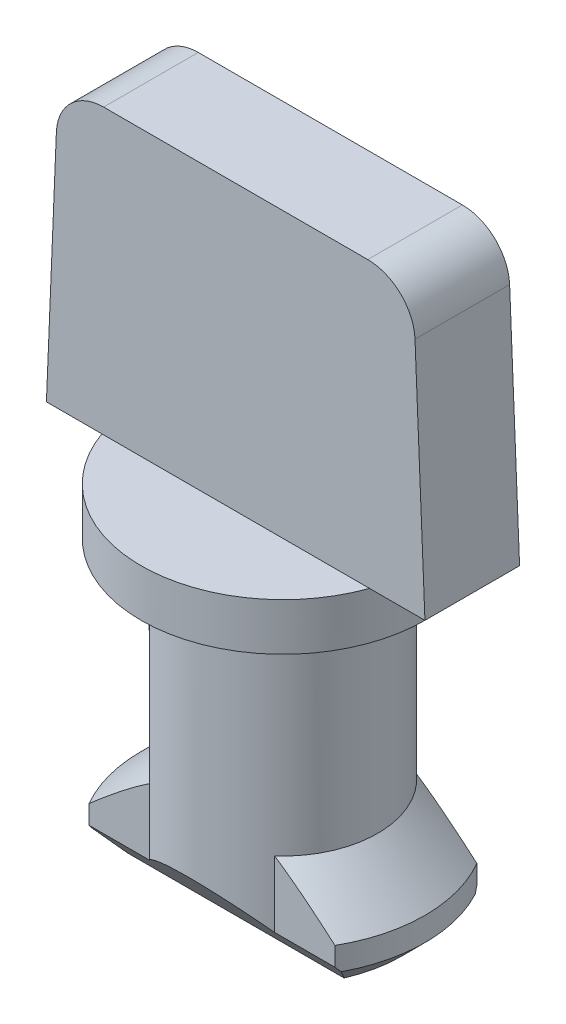
from build123d import *

# Parameters (mm, degrees)
SKETCH_1_R                      = 3
EXTRUDE_1_DEPTH                 = 1
EXTRUDE_2_DEPTH                 = 1
EXTRUDE_2_DEPTH_BACK            = 1
FILLET_1_R                      = 1
SKETCH_3_R                      = 2
EXTRUDE_3_DEPTH                 = 6.4
EXTRUDE_4_DEPTH                 = 2
CHAMFER_1_SIZE                  = 0.5
CHAMFER_2_SIZE                  = 1
CUT_EXTRUDE_1_REACH             = 10.602
CUT_EXTRUDE_1_DIRECTION_2_REACH = 10.602


with BuildPart() as part:
    # 草图1 → 凸台-拉伸1 (new body)
    with BuildSketch(Plane(origin=(0, 0, 0), x_dir=(1, 0, 0), z_dir=(0, 1, 0))):
        with Locations(Location((0, 0, 0), (0, 0, 270))):
            Circle(SKETCH_1_R)
    extrude(amount=EXTRUDE_1_DEPTH)

    # 草图2 → 凸台-拉伸2 (add, two sides: drawn at the far end of the back side and taken through both)
    with BuildSketch(Plane.XY.offset(-EXTRUDE_2_DEPTH_BACK)):
        Polygon((-3.75, 7), (3.75, 7), (4, 1), (-4, 1), align=None)
    extrude(amount=EXTRUDE_2_DEPTH + EXTRUDE_2_DEPTH_BACK)

    # 圆角1
    fillet_1_edges = [part.edges().sort_by_distance(p)[0] for p in [
        (-3.75, 7, 0),
        (3.75, 7, 0),
    ]]
    fillet(fillet_1_edges, radius=FILLET_1_R)

    # 草图3 → 凸台-拉伸3 (add)
    with BuildSketch(Plane(origin=(0, 0, 0), x_dir=(-1, 0, 0), z_dir=(0, -1, 0))):
        with Locations(Location((0, 0, 0), (0, 0, 270))):
            Circle(SKETCH_3_R)
    extrude(amount=EXTRUDE_3_DEPTH)

    # 草图4 → 凸台-拉伸4 (add)
    with BuildSketch(Plane(origin=(0, -6.4, 0), x_dir=(-1, 0, 0), z_dir=(0, -1, 0))):
        with BuildLine():
            Line((2.598076211, -1.5), (-2.598076211, -1.5))
            ThreePointArc((-2.598076211, -1.5), (-3, 0), (-2.598076211, 1.5))
            Line((-2.598076211, 1.5), (2.598076211, 1.5))
            ThreePointArc((2.598076211, 1.5), (3, 0), (2.598076211, -1.5))
        make_face()
    extrude(amount=-EXTRUDE_4_DEPTH)

    # 倒角1
    chamfer_1_edges = [part.edges().sort_by_distance(p)[0] for p in [
        (3, -6.4, 0),
        (-3, -6.4, 0),
    ]]
    chamfer(chamfer_1_edges, length=CHAMFER_1_SIZE)

    # 倒角2
    chamfer_2_edges = [part.edges().sort_by_distance(p)[0] for p in [
        (3, -4.4, 0),
        (-3, -4.4, 0),
    ]]
    chamfer(chamfer_2_edges, length=CHAMFER_2_SIZE - 0.0001)  # a hair under: the kernel refuses the full size

    # 草图5 → 切除-拉伸1 (cut, up to next)
    with BuildSketch(Plane(origin=(0, 0, 0), x_dir=(0, 0, -1), z_dir=(1, 0, 0)), mode=Mode.PRIVATE) as cut_extrude_1_sk1:
        Polygon((2, -5.2), (1, -6.4), (2, -6.4), align=None)
    cut_extrude_1_tool1 = extrude(cut_extrude_1_sk1.sketch, amount=-CUT_EXTRUDE_1_REACH, mode=Mode.PRIVATE) & part.part
    # 草图5 → 切除-拉伸1 (cut, up to next)
    with BuildSketch(Plane(origin=(0, 0, 0), x_dir=(0, 0, -1), z_dir=(1, 0, 0)), mode=Mode.PRIVATE) as cut_extrude_1_sk2:
        Polygon((-2, -5.2), (-2, -6.4), (-1, -6.4), align=None)
    cut_extrude_1_tool2 = extrude(cut_extrude_1_sk2.sketch, amount=-CUT_EXTRUDE_1_REACH, mode=Mode.PRIVATE) & part.part
    add(cut_extrude_1_tool1.solids().sort_by_distance((0, -6, -1.666667))[0], mode=Mode.SUBTRACT)
    add(cut_extrude_1_tool2.solids().sort_by_distance((0, -6, 1.666667))[0], mode=Mode.SUBTRACT)

    # 草图5 → 切除-拉伸1 direction 2 (cut, up to next)
    with BuildSketch(Plane(origin=(0, 0, 0), x_dir=(0, 0, -1), z_dir=(1, 0, 0)), mode=Mode.PRIVATE) as cut_extrude_1_direction_2_sk1:
        Polygon((2, -5.2), (1, -6.4), (2, -6.4), align=None)
    cut_extrude_1_direction_2_tool1 = extrude(cut_extrude_1_direction_2_sk1.sketch, amount=CUT_EXTRUDE_1_DIRECTION_2_REACH, mode=Mode.PRIVATE) & part.part
    # 草图5 → 切除-拉伸1 direction 2 (cut, up to next)
    with BuildSketch(Plane(origin=(0, 0, 0), x_dir=(0, 0, -1), z_dir=(1, 0, 0)), mode=Mode.PRIVATE) as cut_extrude_1_direction_2_sk2:
        Polygon((-2, -5.2), (-2, -6.4), (-1, -6.4), align=None)
    cut_extrude_1_direction_2_tool2 = extrude(cut_extrude_1_direction_2_sk2.sketch, amount=CUT_EXTRUDE_1_DIRECTION_2_REACH, mode=Mode.PRIVATE) & part.part
    add(cut_extrude_1_direction_2_tool1.solids().sort_by_distance((0, -6, -1.666667))[0], mode=Mode.SUBTRACT)
    add(cut_extrude_1_direction_2_tool2.solids().sort_by_distance((0, -6, 1.666667))[0], mode=Mode.SUBTRACT)


solid = part.part
